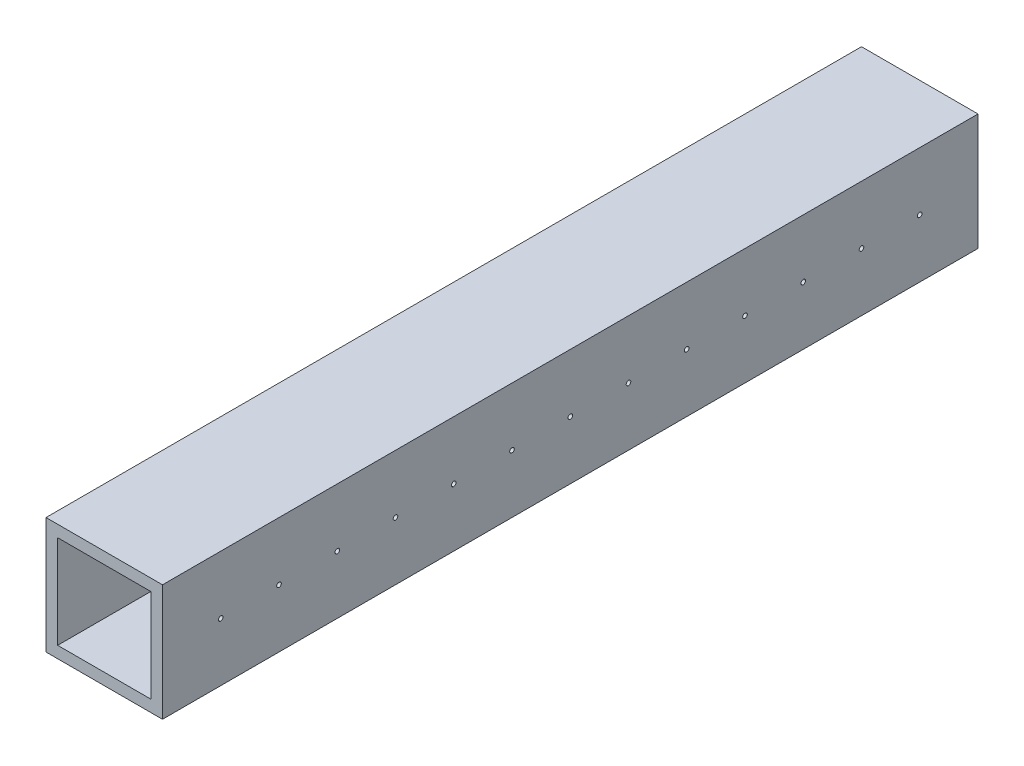
from build123d import *

# Parameters (mm, degrees)
SKETCH1_W               = 25.4
SKETCH1_H               = 25.4
SKETCH1_W_2             = 20.32
SKETCH1_H_2             = 20.32
BOSS_EXTRUDE1_DEPTH     = 177.8
CUT_EXTRUDE1_DEPTH      = 181.115274693
CUT_EXTRUDE1_DEPTH_BACK = 181.115274693
SKETCH2_R               = 0.5


with BuildPart() as part:
    # Sketch1 → Boss-Extrude1 (new body)
    with BuildSketch(Plane.XY):
        with Locations((12.216190476, 0.846666667)):
            Rectangle(SKETCH1_W, SKETCH1_H)
        with Locations((12.216190476, 0.846666667)):
            Rectangle(SKETCH1_W_2, SKETCH1_H_2, mode=Mode.SUBTRACT)
    extrude(amount=BOSS_EXTRUDE1_DEPTH)

    # Sketch2 → Cut-Extrude1 (cut, two sides: drawn at the far end of the back side and taken through both)
    with BuildSketch(Plane(origin=(24.916190476, 0, 0), x_dir=(0, 0, -1), z_dir=(1, 0, 0)).offset(-CUT_EXTRUDE1_DEPTH_BACK)):
        with Locations((-165.1, 0.846666667)):
            Circle(SKETCH2_R)
        with Locations((-152.4, 0.846666667)):
            Circle(SKETCH2_R)
        with Locations((-139.7, 0.846666667)):
            Circle(SKETCH2_R)
        with Locations((-127, 0.846666667)):
            Circle(SKETCH2_R)
        with Locations((-114.3, 0.846666667)):
            Circle(SKETCH2_R)
        with Locations((-101.6, 0.846666667)):
            Circle(SKETCH2_R)
        with Locations((-88.9, 0.846666667)):
            Circle(SKETCH2_R)
        with Locations((-76.2, 0.846666667)):
            Circle(SKETCH2_R)
        with Locations((-63.5, 0.846666667)):
            Circle(SKETCH2_R)
        with Locations((-50.8, 0.846666667)):
            Circle(SKETCH2_R)
        with Locations((-38.1, 0.846666667)):
            Circle(SKETCH2_R)
        with Locations((-25.4, 0.846666667)):
            Circle(SKETCH2_R)
        with Locations((-12.7, 0.846666667)):
            Circle(SKETCH2_R)
    extrude(amount=CUT_EXTRUDE1_DEPTH + CUT_EXTRUDE1_DEPTH_BACK, mode=Mode.SUBTRACT)


solid = part.part
